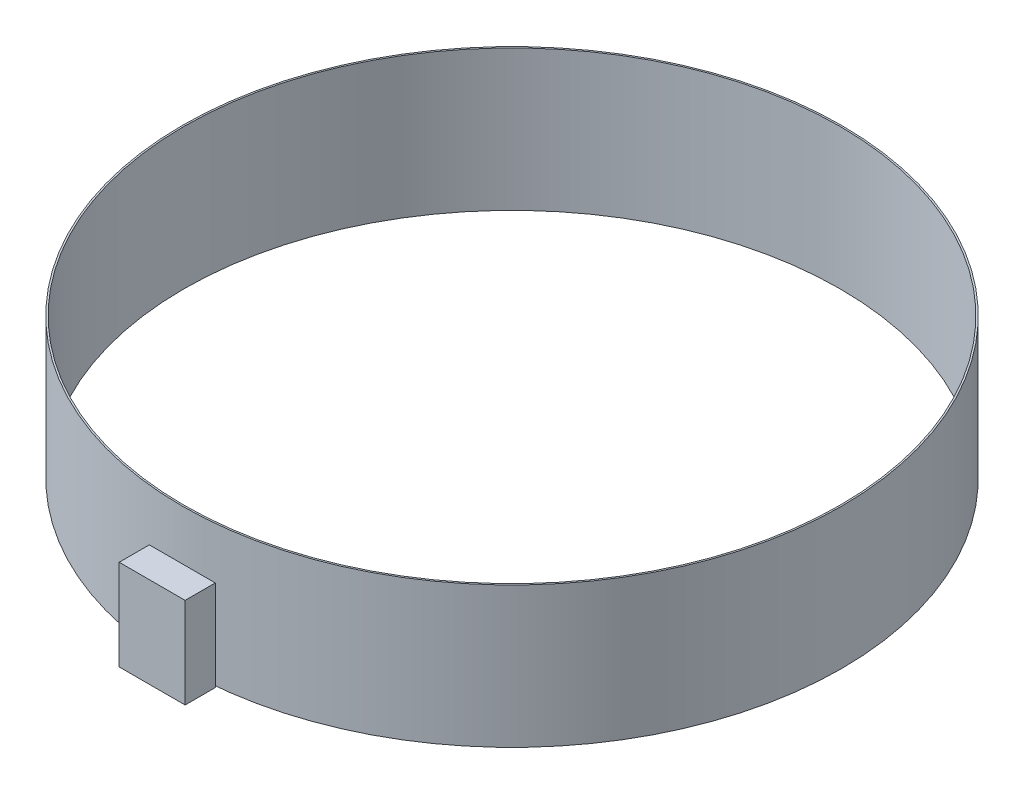
from build123d import *

# Parameters (mm, degrees)
SKETCH1_R           = 10000
BOSS_EXTRUDE1_DEPTH = 4267.2
SKETCH2_R           = 9950
CUT_EXTRUDE1_DEPTH  = 4267.2
SKETCH4_W           = 2000
SKETCH4_H           = 2750
BOSS_EXTRUDE2_DEPTH = 914.4


with BuildPart() as part:
    # Sketch1 → Boss-Extrude1 (new body)
    with BuildSketch(Plane(origin=(0, 0, 0), x_dir=(1, 0, 0), z_dir=(0, 1, 0))):
        Circle(SKETCH1_R)
    extrude(amount=BOSS_EXTRUDE1_DEPTH)

    # Sketch2 → Cut-Extrude1 (cut)
    with BuildSketch(Plane(origin=(0, 4267.2, 0), x_dir=(1, 0, 0), z_dir=(0, 1, 0))):
        Circle(SKETCH2_R)
    extrude(amount=-CUT_EXTRUDE1_DEPTH, mode=Mode.SUBTRACT)


with BuildPart() as body_2:
    # Sketch4 → Boss-Extrude2 (new body)
    with BuildSketch(Plane.XY.offset(10000)):
        with Locations((0, 1375)):
            Rectangle(SKETCH4_W, SKETCH4_H)
    extrude(amount=BOSS_EXTRUDE2_DEPTH)


solid = Compound([part.part, body_2.part])
